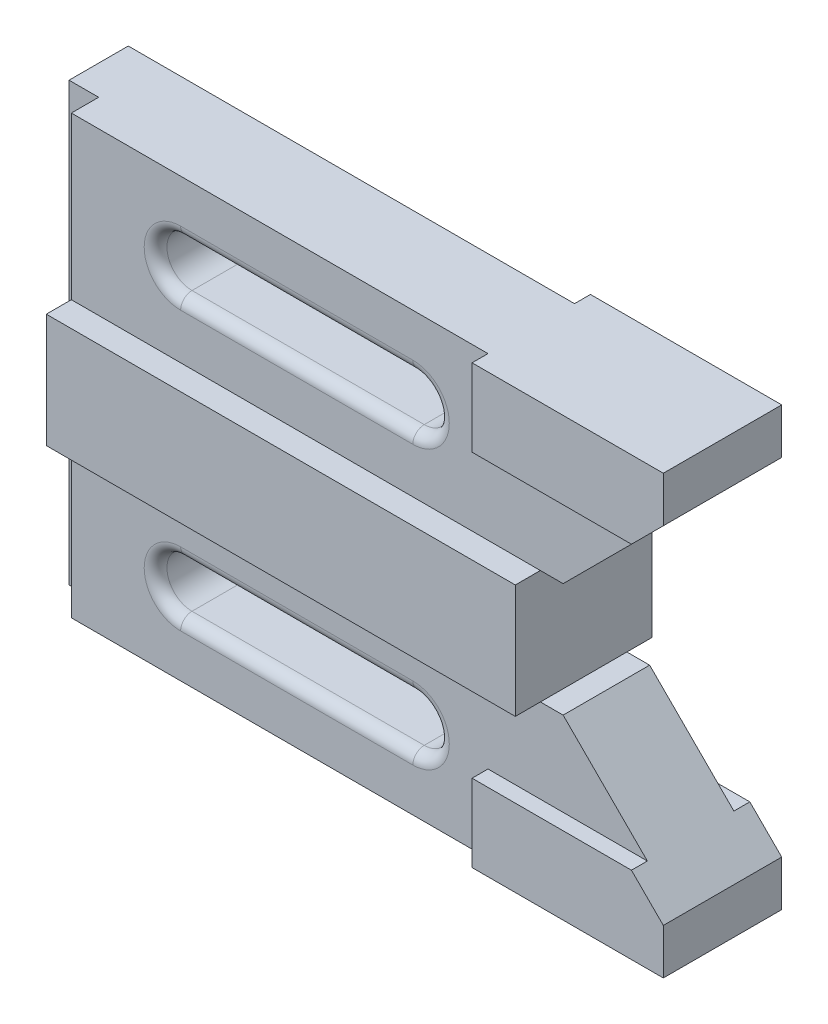
from build123d import *

# Parameters (mm, degrees)
SKETCH1_W           = 109.5
SKETCH1_H           = 12.5
BOSS_EXTRUDE2_DEPTH = 15
BOSS_EXTRUDE3_DEPTH = 9.5
BOSS_EXTRUDE4_DEPTH = 13
SKETCH3_W           = 6.5
SKETCH3_H           = 11.5
CUT_EXTRUDE1_DEPTH  = 96
FILLET1_R           = 2.5


with BuildPart() as part:
    # Sketch1 → Boss-Extrude2 (new, symmetric)
    with BuildSketch(Plane.XY):
        with Locations((54.75, 6.25)):
            Rectangle(SKETCH1_W, SKETCH1_H)
    extrude(amount=BOSS_EXTRUDE2_DEPTH, both=True)

    # Sketch1<4> → Boss-Extrude3 (add, symmetric)
    with BuildSketch(Plane.XY):
        Polygon((0, 30.5), (0, 12.5), (109.5, 12.5), (114.5, 12.5), (133, 31), (98, 31), (98, 48), (0, 48), align=None)
        with BuildLine():
            ThreePointArc((30.5, 25), (26.610912703, 26.610912703), (25, 30.5))
            ThreePointArc((25, 30.5), (26.610912703, 34.389087297), (30.5, 36))
            Line((30.5, 36), (81.5, 36))
            ThreePointArc((81.5, 36), (87, 30.5), (81.5, 25))
            Line((81.5, 25), (30.5, 25))
        make_face(mode=Mode.SUBTRACT)
    extrude(amount=BOSS_EXTRUDE3_DEPTH, both=True)

    # Sketch1<5> → Boss-Extrude4 (add, symmetric)
    with BuildSketch(Plane.XY):
        Polygon((140, 48), (98, 48), (98, 31), (133, 31), (140, 38), align=None)
    extrude(amount=BOSS_EXTRUDE4_DEPTH, both=True)

    # Mirror1: part across plane


with BuildPart() as part_1:
    add(part.part)
    add(part.part.mirror(Plane(origin=(0, 0, 15), x_dir=(0, 0, 1), z_dir=(0, 1, 0))))

    # Sketch3 → Cut-Extrude1 (cut)
    with BuildSketch(Plane(origin=(0, 48, 0), x_dir=(1, 0, 0), z_dir=(0, 1, 0))):
        with Locations((3.25, -9.25)):
            Rectangle(SKETCH3_W, SKETCH3_H)
    extrude(amount=-CUT_EXTRUDE1_DEPTH, mode=Mode.SUBTRACT)

    # Fillet1
    fillet1_edges = [part_1.edges().sort_by_distance(p)[0] for p in [
        (56, -25, 9.5),
        (87, -30.5, 9.5),
        (25, -30.5, 9.5),
        (56, -36, 9.5),
        (25, -30.5, -9.5),
        (56, -25, -9.5),
        (87, -30.5, -9.5),
        (56, -36, -9.5),
        (25, 30.5, -9.5),
        (56, 36, -9.5),
        (56, 25, -9.5),
        (87, 30.5, -9.5),
        (87, 30.5, 9.5),
        (56, 36, 9.5),
        (25, 30.5, 9.5),
        (56, 25, 9.5),
    ]]
    fillet(fillet1_edges, radius=FILLET1_R)


solid = part_1.part
